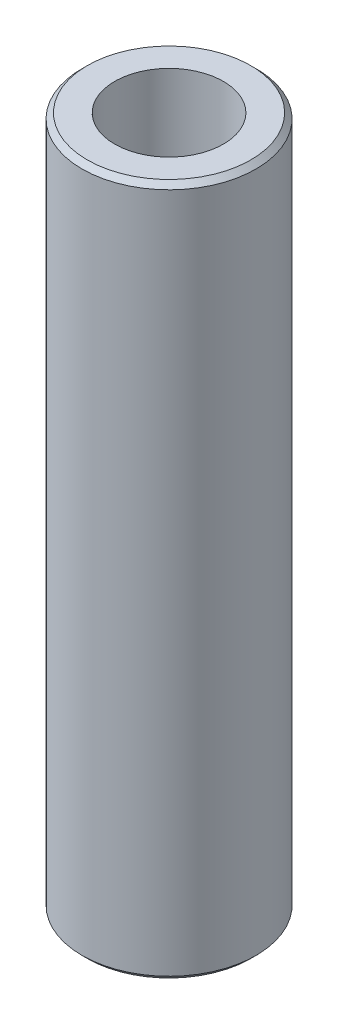
from build123d import *

# Parameters (mm, degrees)
SKETCH1_R           = 35
BOSS_EXTRUDE1_DEPTH = 278.230469037
SKETCH2_R           = 21.87600227
CUT_EXTRUDE1_DEPTH  = 283.598998407
CHAMFER1_SIZE       = 2.107570485


with BuildPart() as part:
    # Sketch1 → Boss-Extrude1 (new body)
    with BuildSketch(Plane(origin=(0, 0, 0), x_dir=(1, 0, 0), z_dir=(0, 1, 0))):
        Circle(SKETCH1_R)
    extrude(amount=BOSS_EXTRUDE1_DEPTH)

    # Sketch2 → Cut-Extrude1 (cut, through all)
    with BuildSketch(Plane(origin=(0, 0, 0), x_dir=(1, 0, 0), z_dir=(0, 1, 0))):
        Circle(SKETCH2_R)
    extrude(amount=CUT_EXTRUDE1_DEPTH, mode=Mode.SUBTRACT)

    # Chamfer1
    chamfer1_edges = [part.edges().sort_by_distance(p)[0] for p in [
        (-35, 278.230469037, 0),
        (-35, 0, 0),
    ]]
    chamfer(chamfer1_edges, length=CHAMFER1_SIZE)


solid = part.part
